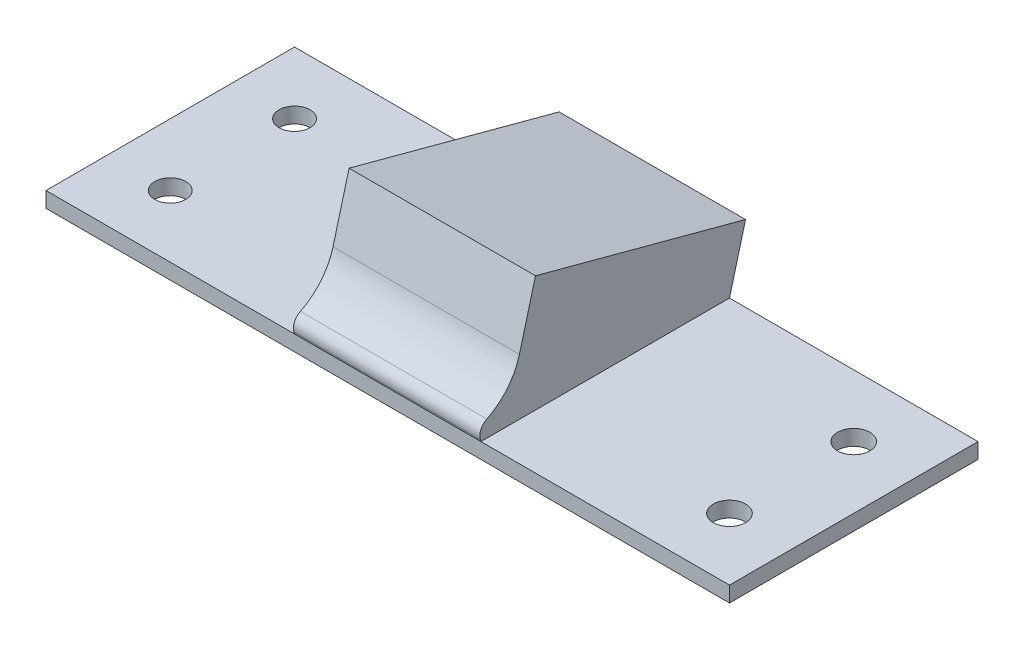
from build123d import *

# Parameters (mm, degrees)
BOSS_EXTRUDE1_DEPTH   = 88.9
SKETCH2_W             = 88.9
SKETCH2_H             = 50.8
BOSS_EXTRUDE2_DEPTH   = 3.175
FILLET2_DEPTH         = 25.4
FILLET2_START         = 63.5
FILLET2_2_DEPTH       = 25.4
FILLET2_START_2       = 25.4
FILLET2_3_DEPTH       = 38.1
FILLET2_4_DEPTH       = 38.1
FILLET2_START_3       = -25.4
FILLET2_5_OUTLINE_W   = 3.175
FILLET2_5_OUTLINE_H   = 50.8
FILLET2_5_DEPTH       = 139.7
FILLET2_START_4       = -10.570754214
FILLET2_6_OUTLINE_R   = 3.302
FILLET2_6_OUTLINE_R_2 = 3.175
FILLET2_6_DEPTH       = 3.175


with BuildPart() as part:
    # Sketch1 → Boss-Extrude1 (new body)
    with BuildSketch(Plane(origin=(0, 0, 0), x_dir=(0, 0, -1), z_dir=(1, 0, 0))):
        Polygon((27.601330486, -7.395754214), (-23.198669514, -7.395754214), (-27.601330486, 7.395754214), align=None)
    extrude(amount=BOSS_EXTRUDE1_DEPTH)

    # Sketch2 → Boss-Extrude2 (add)
    with BuildSketch(Plane.XZ.offset(7.395754214)):
        with Locations((44.45, -2.201330486)):
            Rectangle(SKETCH2_W, SKETCH2_H)
    extrude(amount=BOSS_EXTRUDE2_DEPTH)

    # Fillet2: read off the stored shape, not the designer's step
    # Fillet2 outline → Fillet2 (cut)
    with BuildSketch(Plane.YZ):
        Polygon((-7.395754214, 23.198669514), (-7.395754214, -27.601330486), (7.395754214, 27.601330486), align=None)
    extrude(amount=FILLET2_DEPTH, mode=Mode.SUBTRACT)

    # Fillet2 2 outline → Fillet2 2 (cut)
    with BuildSketch(Plane.YZ.offset(FILLET2_START)):
        Polygon((-7.395754214, 23.198669514), (-7.395754214, -27.601330486), (7.395754214, 27.601330486), align=None)
    extrude(amount=FILLET2_2_DEPTH, mode=Mode.SUBTRACT)

    # Fillet2 3 outline → Fillet2 3 (cut)
    with BuildSketch(Plane.YZ.offset(FILLET2_START_2)):
        with BuildLine():
            Line((7.395754214, 27.601330486), (-7.00664086, 23.314488275))
            ThreePointArc((-7.00664086, 23.314488275), (-5.264031089, 23.20711322), (-4.002401192, 22.000254398))
            ThreePointArc((-4.002401192, 22.000254398), (-0.667927102, 17.789753466), (4.108752341, 15.334072492))
            Line((4.108752341, 15.334072492), (7.395754214, 27.601330486))
        make_face()
    extrude(amount=FILLET2_3_DEPTH, mode=Mode.SUBTRACT)

    # Fillet2 4 outline → Fillet2 4 (add)
    with BuildSketch(Plane.YZ.offset(FILLET2_START_2)):
        with BuildLine():
            Line((4.108752341, 15.334072492), (-7.395754214, -27.601330486))
            Line((-7.395754214, -27.601330486), (-7.730151558, -27.601330486))
            ThreePointArc((-7.730151558, -27.601330486), (-7.39861503, -27.623060538), (-7.072751183, -27.687878887))
            Line((-7.072751183, -27.687878887), (4.87150378, -30.888332359))
            Line((4.87150378, -30.888332359), (16.376010335, 12.04707062))
            Line((16.376010335, 12.04707062), (4.108752341, 15.334072492))
        make_face()
    extrude(amount=FILLET2_4_DEPTH)

    # Fillet2 5 outline → Fillet2 5 (add)
    with BuildSketch(Plane.YZ.offset(FILLET2_START_3)):
        with Locations((-8.983254214, -2.201330486)):
            Rectangle(FILLET2_5_OUTLINE_W, FILLET2_5_OUTLINE_H)
    extrude(amount=FILLET2_5_DEPTH)

    # Fillet2 6 outline → Fillet2 6 (cut)
    with BuildSketch(Plane(origin=(0, 0, 0), x_dir=(1, 0, 0), z_dir=(0, 1, 0)).offset(FILLET2_START_4)):
        with Locations((101.6, -10.498669514)):
            Circle(FILLET2_6_OUTLINE_R)
        with Locations((101.6, 14.901330486)):
            Circle(FILLET2_6_OUTLINE_R)
        with Locations((-12.7, -10.498669514)):
            Circle(FILLET2_6_OUTLINE_R_2)
        with Locations((-12.7, 14.901330486)):
            Circle(FILLET2_6_OUTLINE_R_2)
    extrude(amount=FILLET2_6_DEPTH, mode=Mode.SUBTRACT)


solid = part.part
